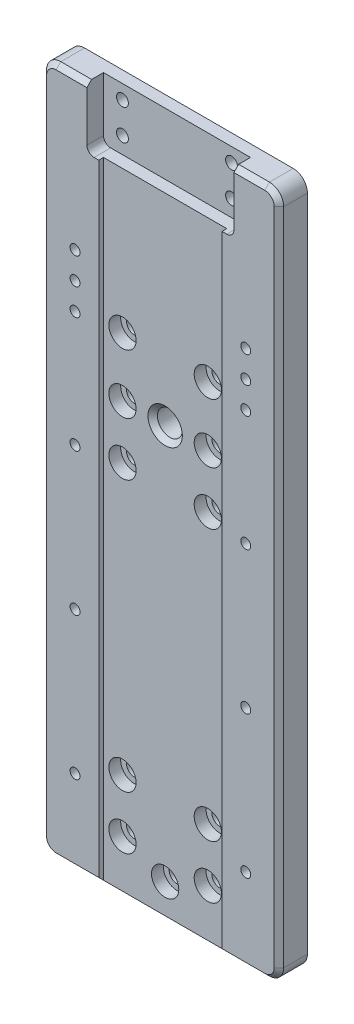
from build123d import *

# Parameters (mm, degrees)
SKETCH1_W           = 100
SKETCH1_H           = 290
BOSS_EXTRUDE1_DEPTH = 6
SKETCH2_W           = 62
SKETCH2_H           = 26
CUT_EXTRUDE1_DEPTH  = 7
SKETCH3_W           = 52
SKETCH3_H           = 290
CUT_EXTRUDE2_DEPTH  = 2
SKETCH4_R           = 2.5
SKETCH4_R_2         = 5.25
SKETCH4_R_3         = 3.3
SKETCH4_R_4         = 2.1
CUT_EXTRUDE4_DEPTH  = 21
FILLET1_R           = 3
FILLET2_R           = 6
CHAMFER1_SIZE       = 2
SKETCH5_R           = 5.75
CUT_EXTRUDE5_DEPTH  = 5
CHAMFER2_SIZE       = 2


with BuildPart() as part:
    # Sketch1 → Boss-Extrude1 (new, symmetric)
    with BuildSketch(Plane.XY):
        Rectangle(SKETCH1_W, SKETCH1_H)
    extrude(amount=BOSS_EXTRUDE1_DEPTH, both=True)

    # Sketch2 → Cut-Extrude1 (cut)
    with BuildSketch(Plane.XY.offset(6)):
        with Locations((0, 132)):
            Rectangle(SKETCH2_W, SKETCH2_H)
    extrude(amount=-CUT_EXTRUDE1_DEPTH, mode=Mode.SUBTRACT)

    # Sketch3 → Cut-Extrude2 (cut)
    with BuildSketch(Plane.XY.offset(6)):
        Rectangle(SKETCH3_W, SKETCH3_H)
    extrude(amount=-CUT_EXTRUDE2_DEPTH, mode=Mode.SUBTRACT)

    # Sketch4 → Cut-Extrude4 (cut)
    with BuildSketch(Plane.XY.offset(-6)):
        with Locations((-23, 139)):
            Circle(SKETCH4_R)
        with Locations((23, 139)):
            Circle(SKETCH4_R)
        with Locations((23, 126)):
            Circle(SKETCH4_R)
        with Locations((-23, 126)):
            Circle(SKETCH4_R)
        with Locations((0, 34)):
            Circle(SKETCH4_R_2)
        with Locations((-18, 59)):
            Circle(SKETCH4_R_3)
        with Locations((-18, 34)):
            Circle(SKETCH4_R_3)
        with Locations((-18, 11.5)):
            Circle(SKETCH4_R_3)
        with Locations((-36, 81.25)):
            Circle(SKETCH4_R_4)
        with Locations((-36, 70)):
            Circle(SKETCH4_R_4)
        with Locations((-36, 58.75)):
            Circle(SKETCH4_R_4)
        with Locations((-36, 10)):
            Circle(SKETCH4_R_4)
        with Locations((-36, -110)):
            Circle(SKETCH4_R_4)
        with Locations((-36, -50)):
            Circle(SKETCH4_R_4)
        with Locations((-18, -102.5)):
            Circle(SKETCH4_R_3)
        with Locations((-18, -125)):
            Circle(SKETCH4_R_3)
        with Locations((18, -102.5)):
            Circle(SKETCH4_R_3)
        with Locations((18, -125)):
            Circle(SKETCH4_R_3)
        with Locations((0, -132.5)):
            Circle(SKETCH4_R_3)
        with Locations((36, 81.25)):
            Circle(SKETCH4_R_4)
        with Locations((36, 70)):
            Circle(SKETCH4_R_4)
        with Locations((36, 58.75)):
            Circle(SKETCH4_R_4)
        with Locations((18, 59)):
            Circle(SKETCH4_R_3)
        with Locations((18, 11.5)):
            Circle(SKETCH4_R_3)
        with Locations((18, 34)):
            Circle(SKETCH4_R_3)
        with Locations((36, 10)):
            Circle(SKETCH4_R_4)
        with Locations((36, -50)):
            Circle(SKETCH4_R_4)
        with Locations((36, -110)):
            Circle(SKETCH4_R_4)
    extrude(amount=CUT_EXTRUDE4_DEPTH, mode=Mode.SUBTRACT)

    # Fillet1
    fillet1_edges = [part.edges().sort_by_distance(p)[0] for p in [
        (31, 119, 2.5),
        (-31, 119, 2.5),
    ]]
    fillet(fillet1_edges, radius=FILLET1_R)

    # Fillet2
    fillet2_edges = [part.edges().sort_by_distance(p)[0] for p in [
        (50, -145, 0),
        (-50, -145, 0),
        (50, 145, 0),
        (-50, 145, 0),
    ]]
    fillet(fillet2_edges, radius=FILLET2_R)

    # Chamfer1
    chamfer1_edges = [part.edges().sort_by_distance(p)[0] for p in [
        (35, -145, 6),
        (48.242640687, -143.242640687, 6),
        (50, 0, 6),
        (48.242640687, 143.242640687, 6),
        (37.5, 145, 6),
        (-35, -145, 6),
        (-48.242640687, -143.242640687, 6),
        (-50, 0, 6),
        (-48.242640687, 143.242640687, 6),
        (-37.5, 145, 6),
    ]]
    chamfer(chamfer1_edges, length=CHAMFER1_SIZE)

    # Sketch5 → Cut-Extrude5 (cut)
    with BuildSketch(Plane.XY.offset(4)):
        with Locations((-18, 59)):
            Circle(SKETCH5_R)
        with Locations((-18, 34)):
            Circle(SKETCH5_R)
        with Locations((-18, 11.5)):
            Circle(SKETCH5_R)
        with Locations((18, 11.5)):
            Circle(SKETCH5_R)
        with Locations((18, 34)):
            Circle(SKETCH5_R)
        with Locations((18, 59)):
            Circle(SKETCH5_R)
        with Locations((18, -102.5)):
            Circle(SKETCH5_R)
        with Locations((-18, -102.5)):
            Circle(SKETCH5_R)
        with Locations((-18, -125)):
            Circle(SKETCH5_R)
        with Locations((0, -132.5)):
            Circle(SKETCH5_R)
        with Locations((18, -125)):
            Circle(SKETCH5_R)
    extrude(amount=-CUT_EXTRUDE5_DEPTH, mode=Mode.SUBTRACT)

    # Chamfer2
    chamfer2_edges = [part.edges().sort_by_distance(p)[0] for p in [
        (-5.25, 34, 4),
    ]]
    chamfer(chamfer2_edges, length=CHAMFER2_SIZE)


solid = part.part
